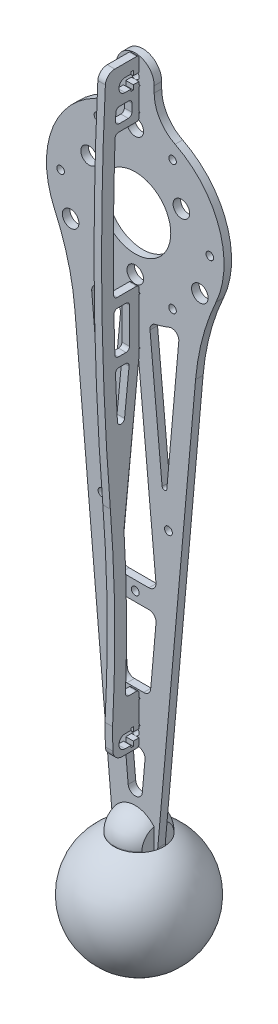
from build123d import *

# Parameters (mm, degrees)
STOCK_TRANSMISSION_MASTER_1_START       = 4.175
STOCK_TRANSMISSION_MASTER_1_OUTLINE_R   = 37.5
STOCK_TRANSMISSION_MASTER_1_OUTLINE_R_2 = 1.6
STOCK_TRANSMISSION_MASTER_1_OUTLINE_R_3 = 3.5
STOCK_TRANSMISSION_MASTER_1_OUTLINE_R_4 = 15
STOCK_TRANSMISSION_MASTER_1_DEPTH       = 3.175
BOSS_EXTRUDE5_START                     = -3.175
BOSS_EXTRUDE5_DEPTH                     = 3.175
CUT_EXTRUDE1_DEPTH                      = 253.816792609
BOSS_EXTRUDE6_DEPTH                     = 3.175
BOSS_EXTRUDE7_DEPTH                     = 3.175
LEG_HOLES_DEPTH                         = 253.816792609
LEG_HOLES_DEPTH_BACK                    = 253.816792609
SKETCH15_R                              = 1.65
SKETCH21_R                              = 1.65
SKETCH21_W                              = 3.175
SKETCH21_H                              = 9.9
EXTRUDE_TAB_HOLE_DEPTH                  = 3.175
CUT_TAB_HOLE_DEPTH                      = 253.816792609
FILLET6_R                               = 3
FILLET8_R                               = 100
FILLET11_R                              = 1
FILLET12_R                              = 3
FILLET13_R                              = 16
SKETCH22_W                              = 3.175
SKETCH22_H                              = 20
SKETCH22_H_2                            = 9.9
BOSS_EXTRUDE20_DEPTH                    = 1.5875
KERF_CORNER_RELIEFS_DEPTH               = 254.379617733
KERF_CORNER_RELIEFS_DEPTH_BACK          = 254.379617733
SKETCH25_R                              = 0.35
FILLET16_R                              = 0.3
SKETCH23_W                              = 2.4
SKETCH23_H                              = 1.65
CUT_EXTRUDE3_DEPTH                      = 3.175
BOSS_EXTRUDE21_DEPTH                    = 3.175
CUT_EXTRUDE6_DEPTH                      = 255.094495737
CUT_EXTRUDE6_DEPTH_BACK                 = 255.094495737
CUT_EXTRUDE7_DEPTH                      = 255.094495737
BOSS_EXTRUDE22_DEPTH                    = 3.175
FILLET19_R                              = 1.5
FILLET20_R                              = 1
FILLET14_R                              = 4
BOSS_EXTRUDE8_START                     = -1.5875
SKETCH10_W                              = 19
SKETCH10_H                              = 20
BOSS_EXTRUDE8_DEPTH                     = 3.175
FOOT_SLOT_DEPTH                         = 1.651
FOOT_FLAT_SIDES_DEPTH                   = 279.668710134
FOOT_FLAT_SIDES_DEPTH_BACK              = 279.668710134
SKETCH12_R                              = 109.984202321
SKETCH13_R                              = 1.75
FOOT_M3_CLEARANCE_DEPTH                 = 279.668710134
FOOT_START                              = 15
SKETCH13_3_R                            = 2.85
SKETCH13_3_R_2                          = 1.75
FOOT_M3_COUNTERBORE_DEPTH               = 10
FOOT_START_2                            = -5
SKETCH13_4_R                            = 2.85
SKETCH13_4_R_2                          = 1.75
FOOT_M3_NUT_TRAP_DEPTH                  = 274.668710134
LPATTERN1_COUNT                         = 2
LPATTERN1_PITCH                         = 15
FILLET10_R                              = 2


# Read off the part's stored shape, not the designer's step: Stock-_transmission_master-1
with BuildPart() as part:
    # Stock-_transmission_master-1 outline → Stock-_transmission_master-1 (new body)
    with BuildSketch(Plane.XY.offset(STOCK_TRANSMISSION_MASTER_1_START)):
        Circle(STOCK_TRANSMISSION_MASTER_1_OUTLINE_R)
        with Locations((-15.75, -27.279800219)):
            Circle(STOCK_TRANSMISSION_MASTER_1_OUTLINE_R_2, mode=Mode.SUBTRACT)
        with Locations((-27.279800219, -15.75)):
            Circle(STOCK_TRANSMISSION_MASTER_1_OUTLINE_R_3, mode=Mode.SUBTRACT)
        with Locations((0, -22.5)):
            Circle(STOCK_TRANSMISSION_MASTER_1_OUTLINE_R_3, mode=Mode.SUBTRACT)
        with Locations((15.75, -27.279800219)):
            Circle(STOCK_TRANSMISSION_MASTER_1_OUTLINE_R_2, mode=Mode.SUBTRACT)
        with Locations((27.279800219, -15.75)):
            Circle(STOCK_TRANSMISSION_MASTER_1_OUTLINE_R_3, mode=Mode.SUBTRACT)
        with Locations((-31.5, 0)):
            Circle(STOCK_TRANSMISSION_MASTER_1_OUTLINE_R_2, mode=Mode.SUBTRACT)
        with Locations((-19.485571585, 11.25)):
            Circle(STOCK_TRANSMISSION_MASTER_1_OUTLINE_R_3, mode=Mode.SUBTRACT)
        with Locations((-15.75, 27.279800219)):
            Circle(STOCK_TRANSMISSION_MASTER_1_OUTLINE_R_2, mode=Mode.SUBTRACT)
        Circle(STOCK_TRANSMISSION_MASTER_1_OUTLINE_R_4, mode=Mode.SUBTRACT)
        with Locations((31.5, 0)):
            Circle(STOCK_TRANSMISSION_MASTER_1_OUTLINE_R_2, mode=Mode.SUBTRACT)
        with Locations((19.485571585, 11.25)):
            Circle(STOCK_TRANSMISSION_MASTER_1_OUTLINE_R_3, mode=Mode.SUBTRACT)
        with Locations((15.75, 27.279800219)):
            Circle(STOCK_TRANSMISSION_MASTER_1_OUTLINE_R_2, mode=Mode.SUBTRACT)
        with Locations((0, 31.5)):
            Circle(STOCK_TRANSMISSION_MASTER_1_OUTLINE_R_3, mode=Mode.SUBTRACT)
    extrude(amount=STOCK_TRANSMISSION_MASTER_1_DEPTH)

    # Sketch5 → Boss-Extrude5 (add)
    with BuildSketch(Plane.XY.offset(7.35).offset(BOSS_EXTRUDE5_START)):
        with BuildLine():
            Line((0, -250), (0, -37.5))
            ThreePointArc((0, -37.5), (-15.003063707, -34.367980438), (-27.5, -25.495097568))
            Line((-27.5, -25.495097568), (-7.5, -250))
            Line((-7.5, -250), (0, -250))
        make_face()
        with BuildLine():
            ThreePointArc((27.5, -25.495097568), (15.003063707, -34.367980438), (0, -37.5))
            Line((0, -37.5), (0, -250))
            Line((0, -250), (7.5, -250))
            Line((7.5, -250), (27.5, -25.495097568))
        make_face()
    extrude(amount=BOSS_EXTRUDE5_DEPTH)

    # Sketch6 → Cut-Extrude1 (cut, through all)
    with BuildSketch(Plane.XY.offset(7.35)):
        with BuildLine():
            ThreePointArc((18.851677931, -32.417036249), (0, -37.5), (-18.851677931, -32.417036249))
            Line((-18.851677931, -32.417036249), (-0.18099756, -242))
            Line((-0.18099756, -242), (0, -244.031741979))
            Line((0, -244.031741979), (0.18099756, -242))
            Line((0.18099756, -242), (18.851677931, -32.417036249))
        make_face()
    extrude(amount=-CUT_EXTRUDE1_DEPTH, mode=Mode.SUBTRACT)

    # Sketch7 → Boss-Extrude6 (add)
    with BuildSketch(Plane.XY.offset(7.35)):
        with BuildLine():
            Line((9.425838966, -134.224389114), (9.051516955, -134.224389114))
            Line((9.051516955, -134.224389114), (9.425838966, -138.224389114))
            Line((9.425838966, -138.224389114), (9.780773006, -134.240167506))
            ThreePointArc((9.780773006, -134.240167506), (9.603481254, -134.228335659), (9.425838966, -134.224389114))
        make_face()
        with BuildLine():
            Line((-9.425838966, -138.224389114), (-9.051516955, -134.224389114))
            Line((-9.051516955, -134.224389114), (-9.425838966, -134.224389114))
            ThreePointArc((-9.425838966, -134.224389114), (-9.603481254, -134.228335659), (-9.780773006, -134.240167506))
            Line((-9.780773006, -134.240167506), (-9.425838966, -138.224389114))
        make_face()
        with BuildLine():
            Line((-9.051516955, -134.224389114), (0, -37.5))
            ThreePointArc((0, -37.5), (-3.00026202, -37.379786353), (-5.981288176, -37.01991615))
            Line((-5.981288176, -37.01991615), (-12.364790552, -105.233937158))
            Line((-12.364790552, -105.233937158), (-9.780773006, -134.240167506))
            ThreePointArc((-9.780773006, -134.240167506), (-9.603481254, -134.228335659), (-9.425838966, -134.224389114))
            Line((-9.425838966, -134.224389114), (-9.051516955, -134.224389114))
        make_face()
        with BuildLine():
            ThreePointArc((5.981288176, -37.01991615), (3.00026202, -37.379786353), (0, -37.5))
            Line((0, -37.5), (9.051516955, -134.224389114))
            Line((9.051516955, -134.224389114), (9.425838966, -134.224389114))
            ThreePointArc((9.425838966, -134.224389114), (9.603481254, -134.228335659), (9.780773006, -134.240167506))
            Line((9.780773006, -134.240167506), (12.364790552, -105.233937158))
            Line((12.364790552, -105.233937158), (5.981288176, -37.01991615))
        make_face()
    extrude(amount=-BOSS_EXTRUDE6_DEPTH)

    # Sketch7<4> → Boss-Extrude7 (add)
    with BuildSketch(Plane.XY.offset(7.35)):
        Polygon((9.051516955, -134.224389114), (-9.051516955, -134.224389114), (-9.425838966, -138.224389114), (9.425838966, -138.224389114), align=None)
        Polygon((9.425838966, -138.224389114), (-9.425838966, -138.224389114), (-9.069499308, -142.224389114), (9.069499308, -142.224389114), align=None)
    extrude(amount=-BOSS_EXTRUDE7_DEPTH)

    # Sketch15 → leg holes (cut, two sides: drawn at the far end of the back side and taken through both)
    with BuildSketch(Plane(origin=(0, 0, 4.175), x_dir=(-1, 0, 0), z_dir=(0, 0, -1)).offset(-LEG_HOLES_DEPTH_BACK)):
        with Locations((0, -138.224389114)):
            Circle(SKETCH15_R)
        with Locations((-14.01722192, -109.224389114)):
            Circle(SKETCH15_R)
        with Locations(Location((14.01722192, -109.224389114, 0), (0, 0, 180))):
            Circle(SKETCH15_R)
    extrude(amount=LEG_HOLES_DEPTH + LEG_HOLES_DEPTH_BACK, mode=Mode.SUBTRACT)

    # Sketch21 → extrude tab hole (add)
    # profile 1 of 3: a face of its own
    with BuildSketch(Plane.XY.offset(7.35)):
        with BuildLine():
            Line((8, 37.5), (8, 50.5))
            ThreePointArc((8, 50.5), (0, 58.5), (-8, 50.5))
            Line((-8, 50.5), (-8, 37.5))
            ThreePointArc((-8, 37.5), (-7.988581524, 37.072723478), (-7.954358693, 36.646666667))
            ThreePointArc((-7.954358693, 36.646666667), (0, 37.5), (7.954358693, 36.646666667))
            ThreePointArc((7.954358693, 36.646666667), (7.988581524, 37.072723478), (8, 37.5))
        make_face()
        with Locations((0, 50.5)):
            Circle(SKETCH21_R, mode=Mode.SUBTRACT)
        with Locations((0, 42.55)):
            Rectangle(SKETCH21_W, SKETCH21_H, mode=Mode.SUBTRACT)
    # profile 2 of 3: a face of its own
    with BuildSketch(Plane.XY.offset(7.35)):
        Polygon((6.2744057, -173.6), (-6.2744057, -173.6), (-4.412530991, -194.5), (4.412530991, -194.5), align=None)
        with Locations((0, -189.5)):
            Circle(SKETCH21_R, mode=Mode.SUBTRACT)
        with Locations((0, -181.55)):
            Rectangle(SKETCH21_W, SKETCH21_H, mode=Mode.SUBTRACT)
    # profile 3 of 3: a face of its own
    with BuildSketch(Plane.XY.offset(7.35)):
        Polygon((-1.40370754, -52.5), (1.40370754, -52.5), (0, -37.5), align=None)
    extrude(amount=-EXTRUDE_TAB_HOLE_DEPTH)

    # Sketch21<5> → cut tab hole (cut, through all)
    with BuildSketch(Plane.XY.offset(7.35)):
        Polygon((0, -37.5), (-1.029385529, -48.5), (1.029385529, -48.5), align=None)
        Polygon((-1.5875, -48.5), (-1.029385529, -48.5), (0, -37.5), (1.029385529, -48.5), (1.5875, -48.5), (1.5875, -28.5), (-1.5875, -28.5), align=None)
    extrude(amount=-CUT_TAB_HOLE_DEPTH, mode=Mode.SUBTRACT)

    # Fillet6
    fillet6_edges = [part.edges().sort_by_distance(p)[0] for p in [
        (-5.981288176, -37.01991615, 5.7625),
        (5.981288176, -37.01991615, 5.7625),
        (-9.069499308, -142.224389114, 5.7625),
        (9.069499308, -142.224389114, 5.7625),
        (9.051516955, -134.224389114, 5.7625),
        (-9.051516955, -134.224389114, 5.7625),
        (-18.851677931, -32.417036249, 5.7625),
        (18.851677931, -32.417036249, 5.7625),
    ]]
    fillet(fillet6_edges, radius=FILLET6_R)

    # Fillet8
    fillet8_edges = [part.edges().sort_by_distance(p)[0] for p in [
        (-27.5, -25.495097568, 5.7625),
        (27.5, -25.495097568, 5.7625),
    ]]
    fillet(fillet8_edges, radius=FILLET8_R)

    # Fillet11
    fillet11_edges = [part.edges().sort_by_distance(p)[0] for p in [
        (-12.364790552, -105.233937158, 5.7625),
        (12.364790552, -105.233937158, 5.7625),
        (1.40370754, -52.5, 5.7625),
        (-1.40370754, -52.5, 5.7625),
    ]]
    fillet(fillet11_edges, radius=FILLET11_R)

    # Fillet12
    fillet12_edges = [part.edges().sort_by_distance(p)[0] for p in [
        (-4.412530991, -194.5, 5.7625),
        (-6.2744057, -173.6, 5.7625),
        (6.2744057, -173.6, 5.7625),
        (4.412530991, -194.5, 5.7625),
        (0, -244.031741979, 5.7625),
    ]]
    fillet(fillet12_edges, radius=FILLET12_R)

    # Fillet13
    fillet13_edges = [part.edges().sort_by_distance(p)[0] for p in [
        (7.954358693, 36.646666667, 5.7625),
        (-7.954358693, 36.646666667, 5.7625),
    ]]
    fillet(fillet13_edges, radius=FILLET13_R)

    # Sketch25 → kerf corner reliefs (cut, two sides: drawn at the far end of the back side and taken through both)
    with BuildSketch(Plane(origin=(0, 0, 4.175), x_dir=(-1, 0, 0), z_dir=(0, 0, -1)).offset(-KERF_CORNER_RELIEFS_DEPTH_BACK)):
        with Locations((-1.5875, -28.5)):
            Circle(SKETCH25_R)
        with Locations((1.5875, -28.5)):
            Circle(SKETCH25_R)
        with Locations((-1.5875, -48.5)):
            Circle(SKETCH25_R)
        with Locations((1.5875, -48.5)):
            Circle(SKETCH25_R)
        with Locations((-1.5875, 47.5)):
            Circle(SKETCH25_R)
        with Locations((1.5875, 47.5)):
            Circle(SKETCH25_R)
        with Locations((1.5875, 37.6)):
            Circle(SKETCH25_R)
        with Locations((-1.5875, 37.6)):
            Circle(SKETCH25_R)
        with Locations((-1.5875, -176.6)):
            Circle(SKETCH25_R)
        with Locations((1.5875, -176.6)):
            Circle(SKETCH25_R)
        with Locations((-1.5875, -186.5)):
            Circle(SKETCH25_R)
        with Locations((1.5875, -186.5)):
            Circle(SKETCH25_R)
    extrude(amount=KERF_CORNER_RELIEFS_DEPTH + KERF_CORNER_RELIEFS_DEPTH_BACK, mode=Mode.SUBTRACT)

    # Fillet16
    fillet16_edges = [part.edges().sort_by_distance(p)[0] for p in [
        (-1.2375, -48.5, 5.7625),
        (1.2375, -48.5, 5.7625),
        (1.5875, -28.85, 5.7625),
        (-1.2375, -28.5, 5.7625),
        (-1.2375, 37.6, 5.7625),
        (1.2375, 37.6, 5.7625),
        (-1.5875, 47.15, 5.7625),
        (1.2375, 47.5, 5.7625),
        (-1.2375, -176.6, 5.7625),
        (1.2375, -176.6, 5.7625),
        (1.5875, -186.15, 5.7625),
        (-1.2375, -186.5, 5.7625),
        (1.5875, -176.95, 5.7625),
        (1.5875, 37.95, 5.7625),
        (-1.5875, 37.95, 5.7625),
        (-1.2375, 47.5, 5.7625),
        (-1.5875, -28.85, 5.7625),
        (1.5875, -48.15, 5.7625),
        (-1.5875, -48.15, 5.7625),
        (1.5875, 47.15, 5.7625),
        (-1.5875, -186.15, 5.7625),
        (1.2375, -186.5, 5.7625),
        (-1.5875, -176.95, 5.7625),
        (1.2375, -28.5, 5.7625),
    ]]
    fillet(fillet16_edges, radius=FILLET16_R)

    # Sketch10 → Boss-Extrude8 (add)
    with BuildSketch(Plane.XY.offset(5.7625).offset(BOSS_EXTRUDE8_START)):
        with Locations((0, -237.549509757)):
            Rectangle(SKETCH10_W, SKETCH10_H)
    extrude(amount=BOSS_EXTRUDE8_DEPTH)


with BuildPart() as body_2:
    # Sketch22 → Boss-Extrude20 (new, symmetric)
    with BuildSketch(Plane(origin=(0, 0, 0), x_dir=(0, 0, -1), z_dir=(1, 0, 0))):
        Polygon((-7.35, -176.6), (-7.35, -48.5), (-7.35, -28.5), (-7.35, 37.6), (-7.35, 47.5), (-7.35, 58.5), (-21.35, 58.5), (-18.35, -194.5), (-7.35, -194.5), (-7.35, -186.5), align=None)
        with Locations((-5.7625, -38.5)):
            Rectangle(SKETCH22_W, SKETCH22_H)
        with Locations((-5.7625, -181.55)):
            Rectangle(SKETCH22_W, SKETCH22_H_2)
        with Locations((-5.7625, 42.55)):
            Rectangle(SKETCH22_W, SKETCH22_H_2)
    extrude(amount=BOSS_EXTRUDE20_DEPTH, both=True)

    # Sketch23 → Cut-Extrude3 (cut)
    with BuildSketch(Plane(origin=(1.5875, 0, 0), x_dir=(0, 0, -1), z_dir=(1, 0, 0))):
        with Locations((-8.55, -190.325)):
            Rectangle(SKETCH23_W, SKETCH23_H)
        with Locations((-8.55, -188.675)):
            Rectangle(SKETCH23_W, SKETCH23_H)
        Polygon((-10.75, -187.85), (-10.75, -191.15), (-9.75, -191.15), (-9.75, -189.5), (-9.75, -187.85), align=None)
        with BuildLine():
            Line((-13.25, -192.25), (-10.75, -192.25))
            Line((-10.75, -192.25), (-10.75, -191.15))
            Line((-10.75, -191.15), (-10.75, -187.85))
            Line((-10.75, -187.85), (-10.75, -186.75))
            Line((-10.75, -186.75), (-13.25, -186.75))
            ThreePointArc((-13.25, -186.75), (-15.017766953, -187.482233047), (-15.75, -189.25))
            Line((-15.75, -189.25), (-15.75, -189.75))
            ThreePointArc((-15.75, -189.75), (-15.017766953, -191.517766953), (-13.25, -192.25))
        make_face()
        Polygon((-10.75, -186.75), (-10.75, -187.85), (-9.75, -187.85), (-9.75, -185.9), (-10.75, -185.9), align=None)
        Polygon((-10.75, -191.15), (-10.75, -192.25), (-10.75, -193.1), (-9.75, -193.1), (-9.75, -191.15), align=None)
        with BuildLine():
            Line((-10.75, 48.85), (-10.75, 52.15))
            Line((-10.75, 52.15), (-10.75, 53.25))
            Line((-10.75, 53.25), (-13.25, 53.25))
            ThreePointArc((-13.25, 53.25), (-15.017766953, 52.517766953), (-15.75, 50.75))
            Line((-15.75, 50.75), (-15.75, 50.25))
            ThreePointArc((-15.75, 50.25), (-15.017766953, 48.482233047), (-13.25, 47.75))
            Line((-13.25, 47.75), (-10.75, 47.75))
            Line((-10.75, 47.75), (-10.75, 48.85))
        make_face()
        Polygon((-9.75, 50.5), (-9.75, 52.15), (-10.75, 52.15), (-10.75, 48.85), (-9.75, 48.85), align=None)
        Polygon((-9.75, 46.9), (-9.75, 48.85), (-10.75, 48.85), (-10.75, 47.75), (-10.75, 46.9), align=None)
        with Locations((-8.55, 49.675)):
            Rectangle(SKETCH23_W, SKETCH23_H)
        with Locations((-8.55, 51.325)):
            Rectangle(SKETCH23_W, SKETCH23_H)
        Polygon((-10.75, 52.15), (-9.75, 52.15), (-9.75, 54.1), (-10.75, 54.1), (-10.75, 53.25), align=None)
    extrude(amount=-CUT_EXTRUDE3_DEPTH, mode=Mode.SUBTRACT)

    # Sketch26 → Boss-Extrude21 (add)
    with BuildSketch(Plane.ZY.offset(1.5875)):
        with BuildLine():
            Line((20.94404251, 24.264251703), (19.452766798, -101.5))
            ThreePointArc((19.452766798, -101.5), (23.071207726, -21.531657996), (21.35, 58.5))
            Line((21.35, 58.5), (20.94404251, 24.264251703))
        make_face()
    extrude(amount=-BOSS_EXTRUDE21_DEPTH)

    # Sketch26<3> → Cut-Extrude6 (cut, two sides: drawn at the far end of the back side and taken through both)
    with BuildSketch(Plane.ZY.offset(1.5875).offset(-CUT_EXTRUDE6_DEPTH_BACK)):
        with BuildLine():
            ThreePointArc((19.452766798, -101.5), (17.643546335, -141.484171002), (18.504150198, -181.5))
            Line((18.504150198, -181.5), (19.452766798, -101.5))
        make_face()
    extrude(amount=CUT_EXTRUDE6_DEPTH + CUT_EXTRUDE6_DEPTH_BACK, mode=Mode.SUBTRACT)

    # Sketch27 → Cut-Extrude7 (cut, through all)
    with BuildSketch(Plane.ZY.offset(1.5875)):
        with BuildLine():
            ThreePointArc((14.468195112, -101.107514205), (16.160965588, -76.318675158), (17.337985789, -51.5))
            Line((17.337985789, -51.5), (7.35, -51.5))
            Line((7.35, -51.5), (7.35, -173.6))
            Line((7.35, -173.6), (13.118189327, -173.6))
            ThreePointArc((13.118189327, -173.6), (12.706250429, -137.333515312), (14.468195112, -101.107514205))
        make_face()
        with BuildLine():
            Line((17.420651591, 34.6), (7.35, 34.6))
            Line((7.35, 34.6), (7.35, -25.5))
            Line((7.35, -25.5), (18.017011711, -25.5))
            ThreePointArc((18.017011711, -25.5), (18.096735322, 4.553749862), (17.420651591, 34.6))
        make_face()
        with BuildLine():
            ThreePointArc((17.479317944, -47.5), (17.748261376, -38.500885403), (17.949398308, -29.5))
            Line((17.949398308, -29.5), (11.35, -29.5))
            Line((11.35, -29.5), (11.35, -47.5))
            Line((11.35, -47.5), (17.479317944, -47.5))
        make_face()
        with BuildLine():
            Line((10.35, 37.6), (17.311617028, 37.6))
            ThreePointArc((17.311617028, 37.6), (17.189001109, 40.750167219), (17.058075107, 43.9))
            Line((17.058075107, 43.9), (10.35, 43.9))
            Line((10.35, 43.9), (10.35, 37.6))
        make_face()
    extrude(amount=-CUT_EXTRUDE7_DEPTH, mode=Mode.SUBTRACT)

    # Sketch28 → Boss-Extrude22 (add)
    with BuildSketch(Plane(origin=(1.5875, 0, 0), x_dir=(0, 0, -1), z_dir=(1, 0, 0))):
        with BuildLine():
            Line((-13.709154337, -112.00331198), (-7.35, -51.5))
            Line((-7.35, -51.5), (-11.372033118, -51.5))
            Line((-11.372033118, -51.5), (-15.341415413, -89.26614981))
            ThreePointArc((-15.341415413, -89.26614981), (-14.919512325, -95.187916554), (-14.468195112, -101.107514205))
            ThreePointArc((-14.468195112, -101.107514205), (-14.064086179, -106.553700165), (-13.709154337, -112.00331198))
        make_face()
    extrude(amount=-BOSS_EXTRUDE22_DEPTH)

    # Fillet19
    fillet19_edges = [body_2.edges().sort_by_distance(p)[0] for p in [
        (0, -173.6, 13.118189327),
        (0, -51.5, 17.337985789),
        (0, -25.5, 18.017011711),
        (0, 34.6, 17.420651591),
        (0, -47.5, 17.479317944),
        (0, -47.5, 11.35),
        (0, -29.5, 11.35),
        (0, -29.5, 17.949398308),
        (0, 37.6, 17.311617028),
        (0, 37.6, 10.35),
        (0, 43.9, 10.35),
        (0, 43.9, 17.058075107),
        (0, -51.5, 11.372033118),
        (0, -89.26614981, 15.341415413),
        (0, -112.00331198, 13.709154337),
    ]]
    fillet(fillet19_edges, radius=FILLET19_R)

    # Fillet20
    fillet20_edges = [body_2.edges().sort_by_distance(p)[0] for p in [
        (0, 34.6, 7.35),
        (0, -25.5, 7.35),
        (0, -51.5, 7.35),
        (0, -173.6, 7.35),
        (0, -194.5, 7.35),
        (0, 58.5, 7.35),
    ]]
    fillet(fillet20_edges, radius=FILLET20_R)

    # Fillet14
    fillet14_edges = [body_2.edges().sort_by_distance(p)[0] for p in [
        (0, -194.5, 18.35),
        (0, 58.5, 21.35),
    ]]
    fillet(fillet14_edges, radius=FILLET14_R)


with BuildPart() as body_3:
    # Sketch8 one side → Revolve3 (revolve)
    with BuildSketch(Plane.XY.offset(5.7625), mode=Mode.PRIVATE) as revolve3_sk:
        with BuildLine():
            Line((10.5, -227.311897391), (10.5, -251))
            ThreePointArc((10.5, -251), (7.424621202, -258.424621202), (0, -261.5))
            Line((0, -261.5), (0, -275))
            ThreePointArc((0, -275), (24.415185492, -255.375752727), (10.5, -227.311897391))
        make_face()
    revolve(revolve3_sk.sketch.rotate(Axis((0, 0, 5.7625), (0, -1, 0)), 180), axis=Axis((0, 0, 5.7625), (0, -1, 0)))


with BuildPart() as body_4:
    # Sketch8<5> one side → foot revolve (revolve)
    with BuildSketch(Plane.XY.offset(5.7625)):
        with BuildLine():
            Line((10.5, -251), (10.5, -227))
            ThreePointArc((10.5, -227), (7.424621202, -219.575378798), (0, -216.5))
            Line((0, -216.5), (0, -261.5))
            ThreePointArc((0, -261.5), (7.424621202, -258.424621202), (10.5, -251))
        make_face()
    revolve(axis=Axis((0, 0, 5.7625), (0, -1, 0)))

    # Sketch11 → foot slot (cut, symmetric)
    with BuildSketch(Plane.XY.offset(5.7625)):
        Polygon((-21.4757167, -211.97663655), (-21.4757167, -247.549509757), (-9.5, -247.549509757), (-9.5, -227.549509757), (-10.887308076, -211.97663655), align=None)
        Polygon((-9.5, -227.549509757), (-9.5, -247.549509757), (-7.718301713, -247.549509757), (7.718301713, -247.549509757), (9.5, -247.549509757), (9.5, -227.549509757), (10.887308076, -211.97663655), (-10.887308076, -211.97663655), align=None)
        Polygon((21.130318843, -211.97663655), (10.887308076, -211.97663655), (9.5, -227.549509757), (9.5, -247.549509757), (21.130318843, -247.549509757), align=None)
    extrude(amount=FOOT_SLOT_DEPTH, both=True, mode=Mode.SUBTRACT)

    # Sketch12 → foot flat sides (cut, two sides: drawn at the far end of the back side and taken through both)
    with BuildSketch(Plane.XY.offset(5.7625).offset(-FOOT_FLAT_SIDES_DEPTH_BACK)):
        with Locations((0, -243.921825572)):
            Circle(SKETCH12_R)
        with BuildLine():
            Line((8, -204.58872799), (8, -283.254923153))
            ThreePointArc((8, -283.254923153), (0, -291.254923153), (-8, -283.254923153))
            Line((-8, -283.254923153), (-8, -204.58872799))
            ThreePointArc((-8, -204.58872799), (0, -196.58872799), (8, -204.58872799))
        make_face(mode=Mode.SUBTRACT)
    extrude(amount=FOOT_FLAT_SIDES_DEPTH + FOOT_FLAT_SIDES_DEPTH_BACK, mode=Mode.SUBTRACT)


with BuildPart() as foot_m3_clearance_tool:
    # Sketch13 → foot m3 clearance (new, symmetric)
    with BuildSketch(Plane.XY.offset(5.7625)):
        with Locations((0, -230)):
            Circle(SKETCH13_R)
    foot_m3_clearance = extrude(amount=FOOT_M3_CLEARANCE_DEPTH, both=True)


with BuildPart() as part_1:
    add(part.part)

    # foot m3 clearance: cut by foot_m3_clearance_tool
    add(foot_m3_clearance_tool.part, mode=Mode.SUBTRACT)


with BuildPart() as body_4_1:
    add(body_4.part)

    # foot m3 clearance: cut by foot_m3_clearance_tool
    add(foot_m3_clearance_tool.part, mode=Mode.SUBTRACT)

    # Sketch13<3> → foot m3 counterbore (cut)
    with BuildSketch(Plane.XY.offset(5.7625).offset(FOOT_START)):
        with Locations(Location((0, -230, 0), (0, 0, 180))):
            Circle(SKETCH13_3_R)
        with Locations((0, -230)):
            Circle(SKETCH13_3_R_2, mode=Mode.SUBTRACT)
    foot_m3_counterbore = extrude(amount=-FOOT_M3_COUNTERBORE_DEPTH, mode=Mode.SUBTRACT)

    # Sketch13<4> → foot m3 nut trap (cut, through all)
    # profile 1 of 2: a face of its own
    with BuildSketch(Plane.XY.offset(5.7625).offset(FOOT_START_2)):
        Polygon((-1.659882024, -232.875), (1.659882024, -232.875), (3.319764048, -230), (1.659882024, -227.125), (-1.659882024, -227.125), (-3.319764048, -230), align=None)
        with Locations(Location((0, -230, 0), (0, 0, 180))):
            Circle(SKETCH13_4_R, mode=Mode.SUBTRACT)
    # profile 2 of 2: a face of its own
    with BuildSketch(Plane.XY.offset(5.7625).offset(FOOT_START_2)):
        with Locations(Location((0, -230, 0), (0, 0, 180))):
            Circle(SKETCH13_4_R)
        with Locations((0, -230)):
            Circle(SKETCH13_4_R_2, mode=Mode.SUBTRACT)
    foot_m3_nut_trap = extrude(amount=-FOOT_M3_NUT_TRAP_DEPTH, mode=Mode.SUBTRACT)


with BuildPart() as lpattern1_tool:
    # LPattern1: foot m3 clearance, foot m3 counterbore, foot m3 nut trap ×2
    with Locations(*[(0, -i * LPATTERN1_PITCH, 0) for i in range(1, LPATTERN1_COUNT)]):
        add(foot_m3_clearance)
        add(foot_m3_counterbore)
        add(foot_m3_nut_trap)


with BuildPart() as part_2:
    add(part_1.part)

    # LPattern1: cut by lpattern1_tool
    add(lpattern1_tool.part, mode=Mode.SUBTRACT)

    # Fillet10
    # the kernel refuses this fillet: 2 mm, written as the material it takes off along each edge
    with BuildSketch(Plane(origin=(-9.5, -247.549509757, -0.795125981), x_dir=(0, 1, 0), z_dir=(0, 0, 1))) as fillet10_piece_1:
        with BuildLine():
            CenterArc((1.988050392, -2), FILLET10_R, 90, 83.733631495)
            Line((0, -1.781698287), (-0.039761008, -1.777332252))
            ThreePointArc((-0.039761008, -1.777332252), (-0.04, -0.890849143), (-0.04, 0))
            Line((-0.04, 0), (0, 0.04))
            Line((0, 0.04), (1.988050392, 0.04))
            Line((1.988050392, 0.04), (1.988050392, 0))
        make_face()
    extrude(amount=13.115251961, mode=Mode.SUBTRACT)
    with BuildSketch(Plane(origin=(9.5, -247.549509757, -0.795125981), x_dir=(0, 1, 0), z_dir=(0, 0, 1))) as fillet10_piece_2:
        with BuildLine():
            CenterArc((1.988050392, 2), FILLET10_R, 186.266368505, 83.733631495)
            Line((0, 1.781698287), (-0.039761008, 1.777332252))
            ThreePointArc((-0.039761008, 1.777332252), (-0.04, 0.890849143), (-0.04, 0))
            Line((-0.04, 0), (0, -0.04))
            Line((0, -0.04), (1.988050392, -0.04))
            Line((1.988050392, -0.04), (1.988050392, 0))
        make_face()
    extrude(amount=13.115251961, mode=Mode.SUBTRACT)


with BuildPart() as body_4_2:
    add(body_4_1.part)

    # LPattern1: cut by lpattern1_tool
    add(lpattern1_tool.part, mode=Mode.SUBTRACT)


solid = Compound([body_2.part, body_3.part, part_2.part, body_4_2.part])
